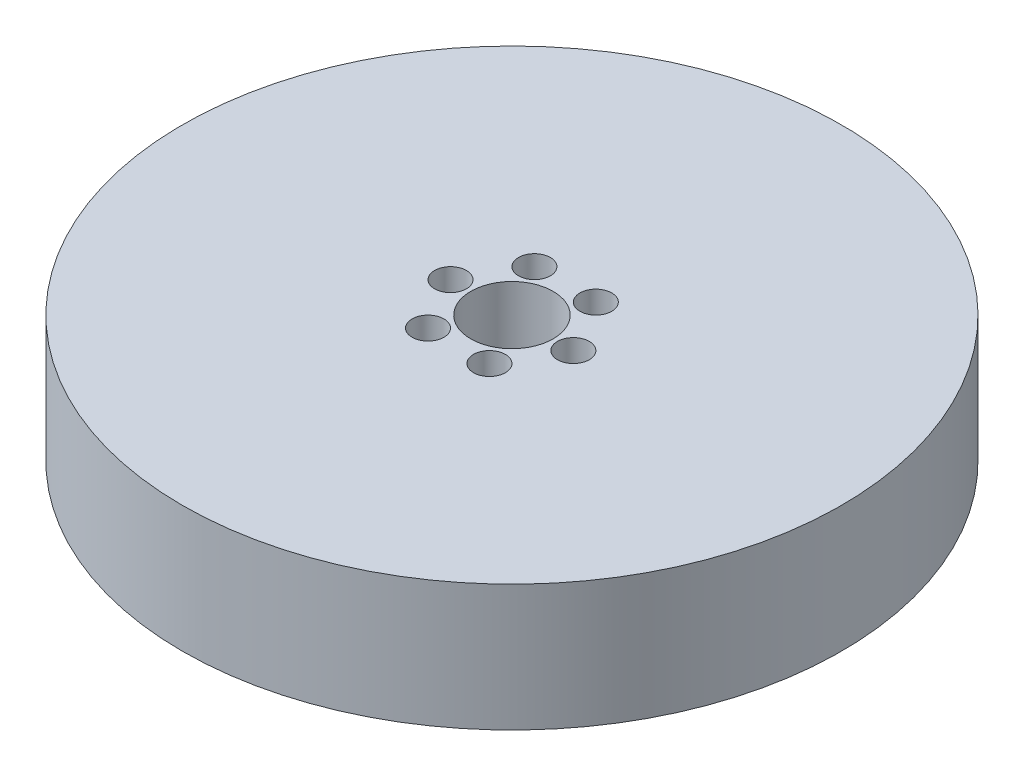
from build123d import *

# Parameters (mm, degrees)
SKETCH1_R           = 60
BOSS_EXTRUDE1_DEPTH = 23
SKETCH2_R           = 7.5
CUT_EXTRUDE1_DEPTH  = 88.914731416
SKETCH3_R           = 2.89900535
CUT_EXTRUDE2_DEPTH  = 17.593173666
CIRPATTERN1_COUNT   = 6


with BuildPart() as part:
    # Sketch1 → Boss-Extrude1 (new body)
    with BuildSketch(Plane(origin=(0, 0, 0), x_dir=(1, 0, 0), z_dir=(0, 1, 0))):
        Circle(SKETCH1_R)
    extrude(amount=BOSS_EXTRUDE1_DEPTH)

    # Sketch2 → Cut-Extrude1 (cut, through all)
    with BuildSketch(Plane(origin=(0, 0, 0), x_dir=(1, 0, 0), z_dir=(0, 1, 0))):
        Circle(SKETCH2_R)
    extrude(amount=CUT_EXTRUDE1_DEPTH, mode=Mode.SUBTRACT)

    # Sketch3 → Cut-Extrude2 (cut)
    with BuildSketch(Plane(origin=(0, 23, 0), x_dir=(1, 0, 0), z_dir=(0, 1, 0))):
        with Locations((-11.182928406, 0)):
            Circle(SKETCH3_R)
    cut_extrude2 = extrude(amount=-CUT_EXTRUDE2_DEPTH, mode=Mode.SUBTRACT)

    # CirPattern1: Cut-Extrude2 ×6 about axis
    cirpattern1_axis = Axis((0, 0, 0), (0, 1, 0))
    for i in range(1, CIRPATTERN1_COUNT):
        add(cut_extrude2.rotate(cirpattern1_axis, i * 360 / CIRPATTERN1_COUNT), mode=Mode.SUBTRACT)


solid = part.part
